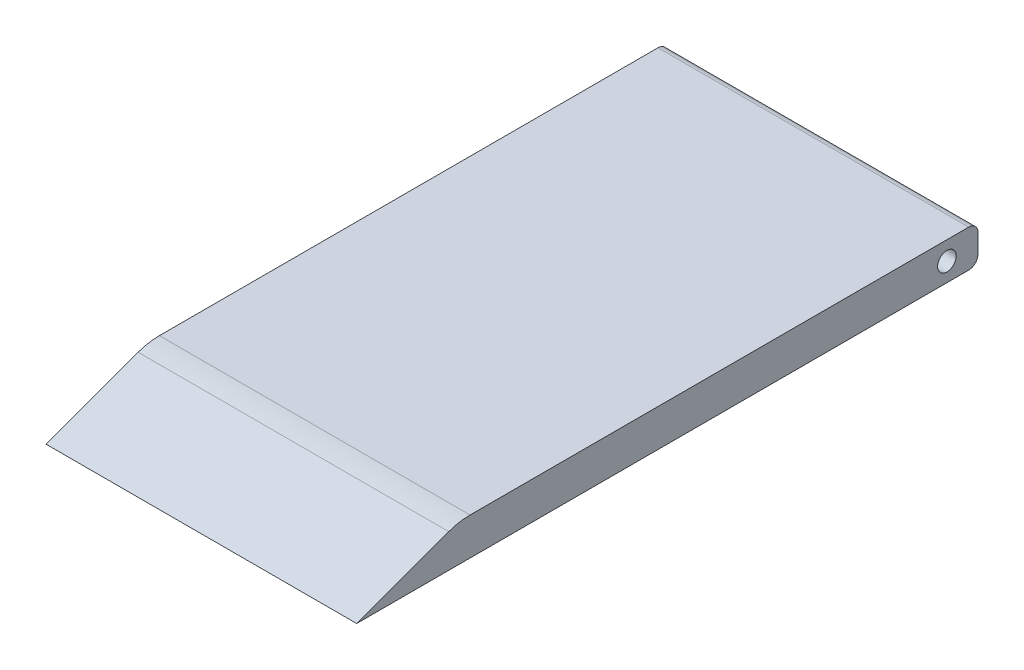
from build123d import *

# Parameters (mm, degrees)
SKETCH1_W           = 50
SKETCH1_H           = 100
BOSS_EXTRUDE1_DEPTH = 6
SKETCH2_R           = 1.5
CUT_EXTRUDE1_DEPTH  = 112.964280018
FILLET2_R           = 1.5
CHAMFER1_SIZE2      = 16.484864517
CHAMFER1_SIZE       = 6
FILLET3_R           = 10


with BuildPart() as part:
    # Sketch1 → Boss-Extrude1 (new body)
    with BuildSketch(Plane(origin=(0, 0, 0), x_dir=(1, 0, 0), z_dir=(0, 1, 0))):
        with Locations((25, -50)):
            Rectangle(SKETCH1_W, SKETCH1_H)
    extrude(amount=BOSS_EXTRUDE1_DEPTH)

    # Sketch2 → Cut-Extrude1 (cut, through all)
    with BuildSketch(Plane(origin=(50, 0, 0), x_dir=(0, 0, -1), z_dir=(1, 0, 0))):
        with Locations((-5, 3)):
            Circle(SKETCH2_R)
    extrude(amount=-CUT_EXTRUDE1_DEPTH, mode=Mode.SUBTRACT)

    # Fillet2
    fillet2_edges = [part.edges().sort_by_distance(p)[0] for p in [
        (25, 6, 0),
        (25, 0, 0),
    ]]
    fillet(fillet2_edges, radius=FILLET2_R)

    # Chamfer1
    chamfer1_edges = [part.edges().sort_by_distance(p)[0] for p in [
        (25, 6, 100),
    ]]
    chamfer1_side = [part.faces().sort_by_distance(p)[0] for p in [
        (25, 5.88, 100),
    ]]
    chamfer(chamfer1_edges, length=CHAMFER1_SIZE - 0.0001, length2=CHAMFER1_SIZE2 - 0.0001, reference=chamfer1_side[0])  # a hair under: the kernel refuses the full size

    # Fillet3
    fillet3_edges = [part.edges().sort_by_distance(p)[0] for p in [
        (25, 6, 83.515235483),
    ]]
    fillet(fillet3_edges, radius=FILLET3_R)


solid = part.part
